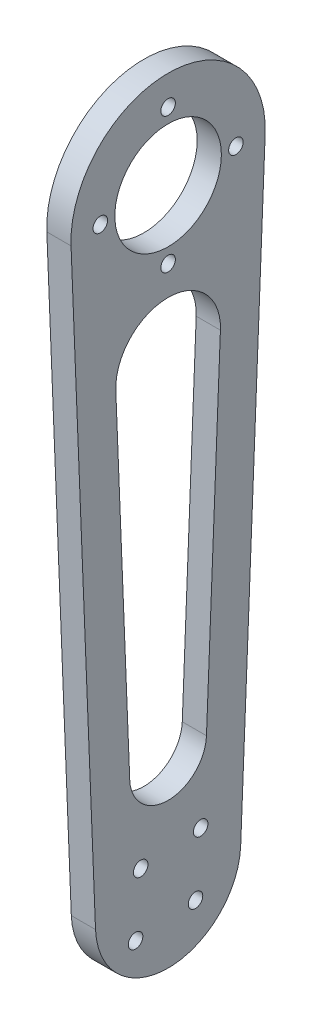
from build123d import *

# Parameters (mm, degrees)
SKETCH1_R           = 1.5
SKETCH1_R_2         = 11
BOSS_EXTRUDE1_DEPTH = 5


with BuildPart() as part:
    # Sketch1 → Boss-Extrude1 (new body)
    with BuildSketch(Plane.YZ):
        with BuildLine():
            Line((-0.8120288, 20.043557799), (-125.6072, 14.987705233))
            ThreePointArc((-125.6072, 14.987705233), (-140, 0), (-125.6072, -14.987705233))
            Line((-125.6072, -14.987705233), (-0.8120288, -20.043557799))
            ThreePointArc((-0.8120288, -20.043557799), (20.06, 0), (-0.8120288, 20.043557799))
        make_face()
        with BuildLine():
            ThreePointArc((-31.3079712, 10.801506793), (-20.06, 0), (-31.3079712, -10.801506793))
            Line((-31.3079712, -10.801506793), (-102.3928, -7.921632431))
            ThreePointArc((-102.3928, -7.921632431), (-110, 0), (-102.3928, 7.921632431))
            Line((-102.3928, 7.921632431), (-31.3079712, 10.801506793))
        make_face(mode=Mode.SUBTRACT)
        with Locations((0, 14)):
            Circle(SKETCH1_R, mode=Mode.SUBTRACT)
        with Locations((0, -14)):
            Circle(SKETCH1_R, mode=Mode.SUBTRACT)
        with Locations((-14, 0)):
            Circle(SKETCH1_R, mode=Mode.SUBTRACT)
        Circle(SKETCH1_R_2, mode=Mode.SUBTRACT)
        with Locations((14, 0)):
            Circle(SKETCH1_R, mode=Mode.SUBTRACT)
        with Locations((-130.656854249, -5.656854249)):
            Circle(SKETCH1_R, mode=Mode.SUBTRACT)
        with Locations((-118.282485579, -6.717514421)):
            Circle(SKETCH1_R, mode=Mode.SUBTRACT)
        with Locations((-131.717514421, 6.717514421)):
            Circle(SKETCH1_R, mode=Mode.SUBTRACT)
        with Locations((-119.343145751, 5.656854249)):
            Circle(SKETCH1_R, mode=Mode.SUBTRACT)
    extrude(amount=BOSS_EXTRUDE1_DEPTH)


solid = part.part
